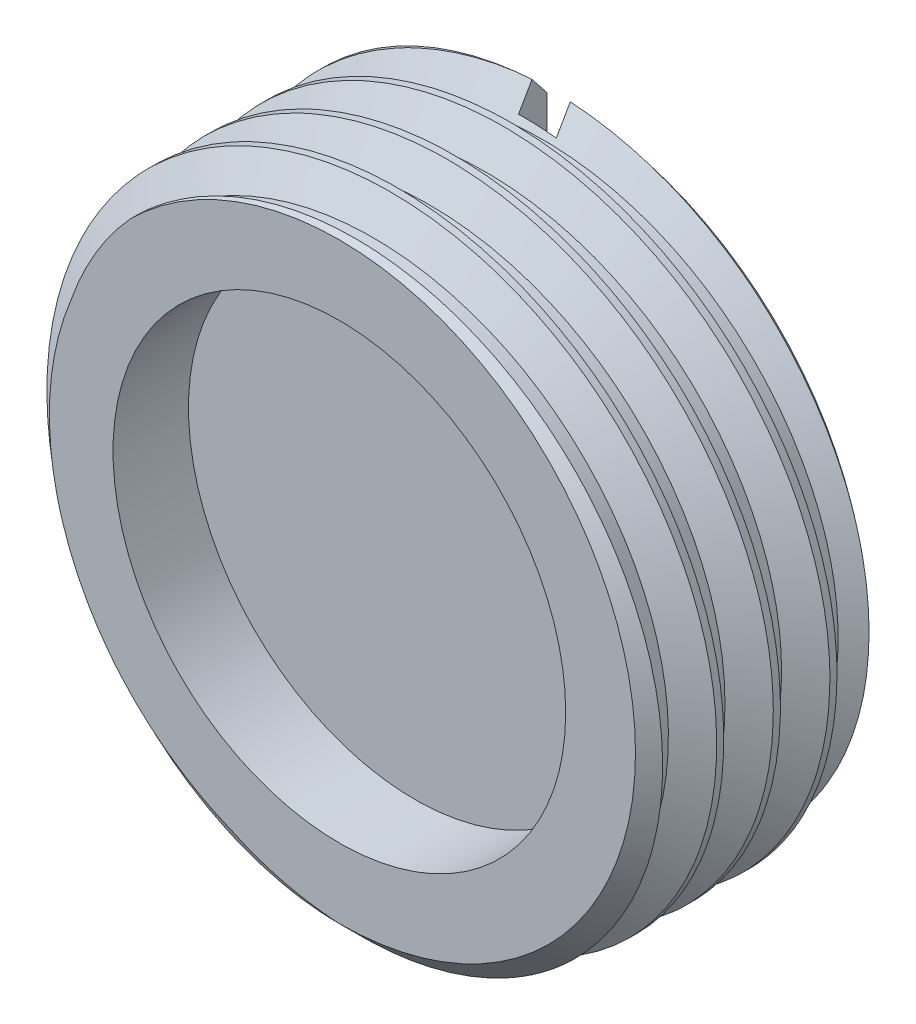
from build123d import *

# Parameters (mm, degrees)
ESQUISSE1_R             = 8.5
BOSS_EXTRU_1_DEPTH      = 6
FILETAGE1_PITCH         = 1.5
ESQUISSE4_R             = 6
ENL_V_MAT_EXTRU_1_DEPTH = 2
ESQUISSE5_W             = 1
ESQUISSE5_H             = 17
ENL_V_MAT_EXTRU_2_DEPTH = 0.75


with BuildPart() as part:
    # Esquisse1 → Boss.-Extru.1 (new body)
    with BuildSketch(Plane.XY):
        Circle(ESQUISSE1_R)
    extrude(amount=BOSS_EXTRU_1_DEPTH)

    # Filetage1: the profile of Profil de filetage1 profile screwed along a right-hand helix of 5 turns, 8 arcs to a turn; built about Z, then put on its axis
    filetage1_z = Axis((0, 0, 0), (0, 0, 1))
    filetage1_corners = [(8.5003, 0, -0.000173205), (8.5003, 0, 1.312673201), (7.688101188, 0, 0.843749998), (7.688101188, 0, 0.468749998)]
    with BuildLine(mode=Mode.PRIVATE) as filetage1_profile:
        Line(filetage1_corners[0], filetage1_corners[1])
        Line(filetage1_corners[1], filetage1_corners[2])
        Line(filetage1_corners[2], filetage1_corners[3])
        Line(filetage1_corners[3], filetage1_corners[0])
    filetage1_cap = Face(filetage1_profile.wire())
    filetage1_turn_angles = [0, 22.5, 45, 67.5, 90, 112.5, 135, 157.5, 180, 202.5, 225, 247.5, 270, 292.5, 315, 337.5, 360]
    filetage1_turn_weights = [1, 0.9238795325112867, 1, 0.9238795325112867, 1, 0.9238795325112867, 1, 0.9238795325112867, 1, 0.9238795325112867, 1, 0.9238795325112867, 1, 0.9238795325112867, 1, 0.9238795325112867, 1]
    filetage1_turn_rails = [Edge.make_bspline([Vector(p[0], p[1], 0).rotate(filetage1_z, filetage1_turn_angles[k]) / filetage1_turn_weights[k] + Vector(0, 0, p[2] + FILETAGE1_PITCH * filetage1_turn_angles[k] / 360) for k in range(17)], [0, 0, 0, 1, 1, 2, 2, 3, 3, 4, 4, 5, 5, 6, 6, 7, 7, 8, 8, 8], 2, filetage1_turn_weights) for p in filetage1_corners]
    filetage1_turn_sides = [Face.make_surface_from_curves(filetage1_turn_rails[p[0]], filetage1_turn_rails[p[1]]) for p in [(0, 1), (1, 2), (2, 3), (3, 0)]]
    filetage1 = Plane(origin=(0, 0, -1.5), x_dir=(1, 0, 0), z_dir=(0, 0, 1)) * Solid(Shell([*[p.moved(Location((0, 0, FILETAGE1_PITCH * i))) for i in range(5) for p in filetage1_turn_sides], filetage1_cap, filetage1_cap.rotate(filetage1_z, 1800).moved(Location((0, 0, FILETAGE1_PITCH * 1800 / 360)))]))
    add(filetage1, mode=Mode.SUBTRACT)

    # Esquisse4 → Enlèv. mat.-Extru.1 (cut)
    with BuildSketch(Plane.XY.offset(6)):
        Circle(ESQUISSE4_R)
    extrude(amount=-ENL_V_MAT_EXTRU_1_DEPTH, mode=Mode.SUBTRACT)

    # Esquisse5 → Enlèv. mat.-Extru.2 (cut)
    with BuildSketch(Plane(origin=(0, 0, 0), x_dir=(-1, 0, 0), z_dir=(0, 0, -1))):
        Rectangle(ESQUISSE5_W, ESQUISSE5_H)
    extrude(amount=-ENL_V_MAT_EXTRU_2_DEPTH, mode=Mode.SUBTRACT)

    # Esquisse6 → Enlèvement de matière-Révolution1 (revolve, cut)
    with BuildSketch(Plane(origin=(0, 0, 0), x_dir=(1, 0, 0), z_dir=(0, 1, 0))):
        Polygon((-8, 0), (-8.5, -0.4), (-8.5, 0), align=None)
        Polygon((-8.5, -5.35), (-7.85, -6), (-8.5, -6), align=None)
    revolve(axis=Axis((0, 0, 0), (0, 0, 1)), mode=Mode.SUBTRACT)


solid = part.part
